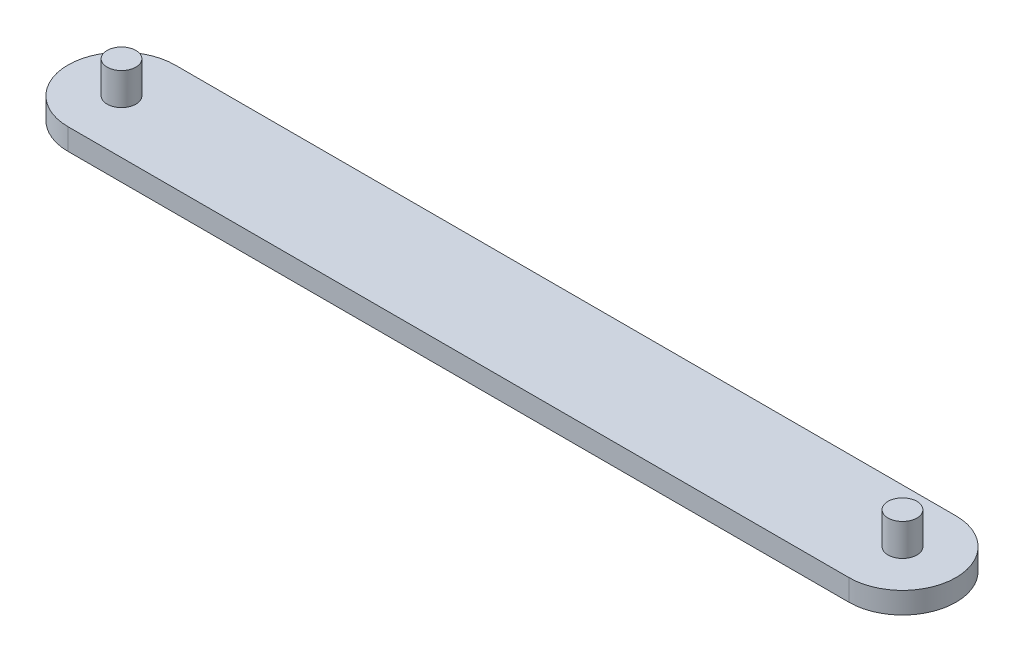
from build123d import *

# Parameters (mm, degrees)
BOSS_EXTRUDE1_DEPTH = 2
SKETCH4_R           = 1.35
BOSS_EXTRUDE2_DEPTH = 3


with BuildPart() as part:
    # Sketch1 → Boss-Extrude1 (new body)
    with BuildSketch(Plane(origin=(0, 0, 0), x_dir=(1, 0, 0), z_dir=(0, 1, 0))):
        with BuildLine():
            Line((0, 0), (-73, 0))
            ThreePointArc((-73, 0), (-78, -5), (-73, -10))
            Line((-73, -10), (0, -10))
            ThreePointArc((0, -10), (5, -5), (0, 0))
        make_face()
    extrude(amount=BOSS_EXTRUDE1_DEPTH)

    # Sketch4 → Boss-Extrude2 (add)
    with BuildSketch(Plane(origin=(0, 2, 0), x_dir=(1, 0, 0), z_dir=(0, 1, 0))):
        with Locations((-73, -5)):
            Circle(SKETCH4_R)
        with Locations((0, -5)):
            Circle(SKETCH4_R)
    extrude(amount=BOSS_EXTRUDE2_DEPTH)


solid = part.part
